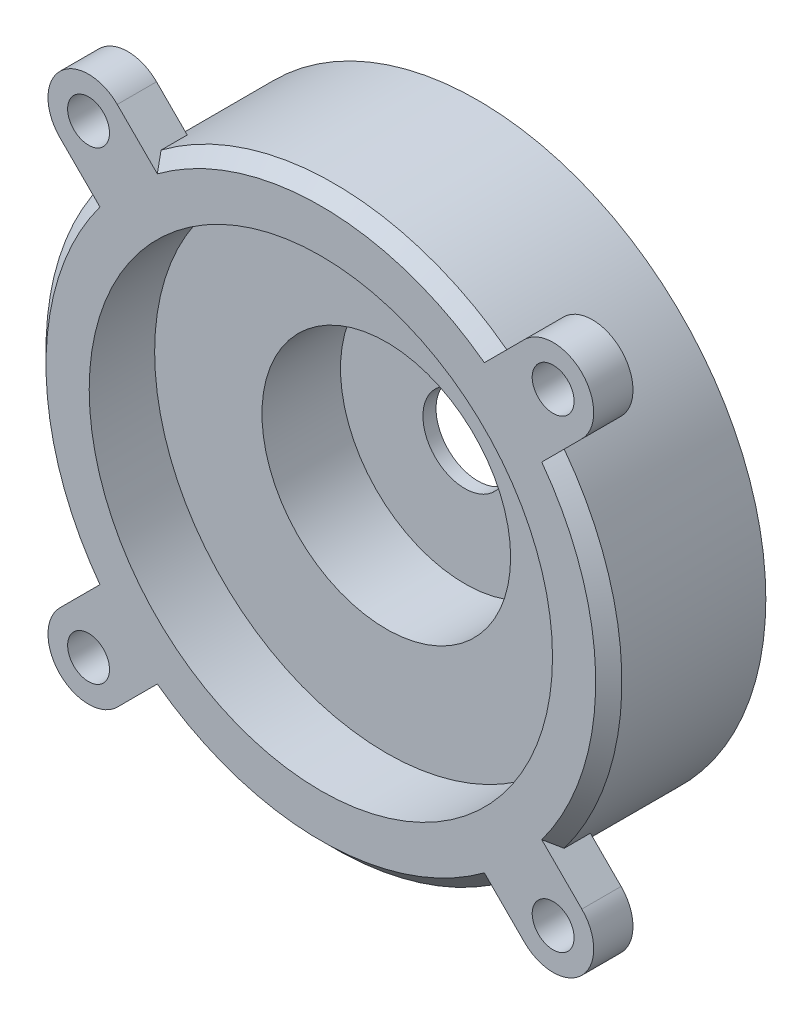
from build123d import *

# Parameters (mm, degrees)
SKETCH1_R           = 22
BOSS_EXTRUDE1_DEPTH = 6
CHAMFER1_SIZE       = 1
SKETCH8_R           = 1.6
BOSS_EXTRUDE2_DEPTH = 3
SKETCH9_R           = 17.7
CUT_EXTRUDE1_DEPTH  = 5
SKETCH10_R          = 9.5
CUT_EXTRUDE2_DEPTH  = 6
SKETCH11_R          = 3.2
CUT_EXTRUDE3_DEPTH  = 1


with BuildPart() as part:
    # Sketch1 → Boss-Extrude1 (new, symmetric)
    with BuildSketch(Plane.XY):
        Circle(SKETCH1_R)
    extrude(amount=BOSS_EXTRUDE1_DEPTH, both=True)

    # Chamfer1
    chamfer1_edges = [part.edges().sort_by_distance(p)[0] for p in [
        (-22, 0, 6),
    ]]
    chamfer(chamfer1_edges, length=CHAMFER1_SIZE)

    # Sketch8 → Boss-Extrude2 (add)
    # profile 1 of 4: a face of its own
    with BuildSketch(Plane.XY.offset(6)):
        with BuildLine():
            Line((15.556349186, 19.940411229), (12.494527459, 16.878589502))
            Line((12.494527459, 16.878589502), (16.878589502, 12.494527459))
            Line((16.878589502, 12.494527459), (19.940411229, 15.556349186))
            ThreePointArc((19.940411229, 15.556349186), (19.940411229, 19.940411229), (15.556349186, 19.940411229))
        make_face()
        with Locations((17.748380208, 17.748380208)):
            Circle(SKETCH8_R, mode=Mode.SUBTRACT)
    # profile 2 of 4: a face of its own
    with BuildSketch(Plane.XY.offset(6)):
        with BuildLine():
            Line((19.940411229, -15.556349186), (16.878589502, -12.494527459))
            Line((16.878589502, -12.494527459), (12.494527459, -16.878589502))
            Line((12.494527459, -16.878589502), (15.556349186, -19.940411229))
            ThreePointArc((15.556349186, -19.940411229), (19.940411229, -19.940411229), (19.940411229, -15.556349186))
        make_face()
        with Locations((17.748380208, -17.748380208)):
            Circle(SKETCH8_R, mode=Mode.SUBTRACT)
    # profile 3 of 4: a face of its own
    with BuildSketch(Plane.XY.offset(6)):
        with BuildLine():
            Line((-15.556349186, -19.940411229), (-12.494527459, -16.878589502))
            Line((-12.494527459, -16.878589502), (-16.878589502, -12.494527459))
            Line((-16.878589502, -12.494527459), (-19.940411229, -15.556349186))
            ThreePointArc((-19.940411229, -15.556349186), (-19.940411229, -19.940411229), (-15.556349186, -19.940411229))
        make_face()
        with Locations((-17.748380208, -17.748380208)):
            Circle(SKETCH8_R, mode=Mode.SUBTRACT)
    # profile 4 of 4: a face of its own
    with BuildSketch(Plane.XY.offset(6)):
        with BuildLine():
            Line((-19.940411229, 15.556349186), (-16.878589502, 12.494527459))
            Line((-16.878589502, 12.494527459), (-12.494527459, 16.878589502))
            Line((-12.494527459, 16.878589502), (-15.556349186, 19.940411229))
            ThreePointArc((-15.556349186, 19.940411229), (-19.940411229, 19.940411229), (-19.940411229, 15.556349186))
        make_face()
        with Locations((-17.748380208, 17.748380208)):
            Circle(SKETCH8_R, mode=Mode.SUBTRACT)
    extrude(amount=-BOSS_EXTRUDE2_DEPTH)

    # Sketch9 → Cut-Extrude1 (cut)
    with BuildSketch(Plane.XY.offset(6)):
        Circle(SKETCH9_R)
    extrude(amount=-CUT_EXTRUDE1_DEPTH, mode=Mode.SUBTRACT)

    # Sketch10 → Cut-Extrude2 (cut)
    with BuildSketch(Plane.XY.offset(1)):
        Circle(SKETCH10_R)
    extrude(amount=-CUT_EXTRUDE2_DEPTH, mode=Mode.SUBTRACT)

    # Sketch11 → Cut-Extrude3 (cut)
    with BuildSketch(Plane.XY.offset(-5)):
        Circle(SKETCH11_R)
    extrude(amount=-CUT_EXTRUDE3_DEPTH, mode=Mode.SUBTRACT)


solid = part.part
